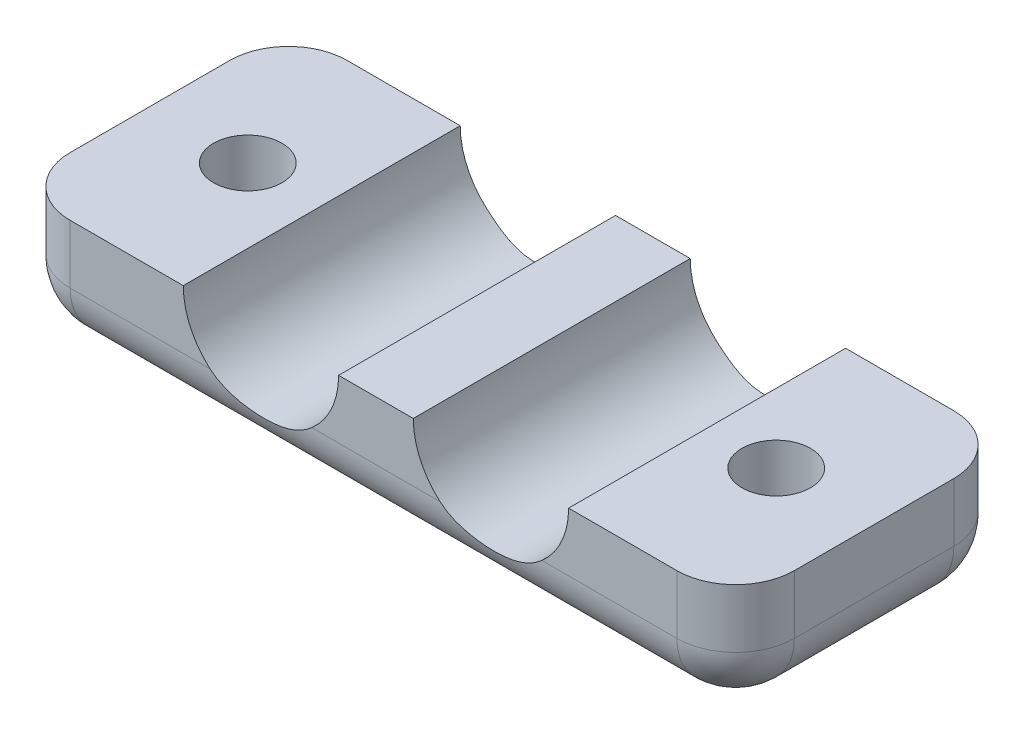
from build123d import *

# Parameters (mm, degrees)
ESBO_O1_W                = 37
ESBO_O1_H                = 6
RESSALTO_EXTRUS_O1_DEPTH = 14.15
ESBO_O2_R                = 3.96875
CORTE_EXTRUS_O1_DEPTH    = 25.051455257
ESBO_O3_R                = 1.75
CORTE_EXTRUS_O2_DEPTH    = 13
FILETE2_R                = 3
FILETE3_R                = 3


with BuildPart() as part:
    # Esboço1 → Ressalto-extrusão1 (new body)
    with BuildSketch(Plane.XY):
        with Locations((0, -3)):
            Rectangle(ESBO_O1_W, ESBO_O1_H)
    extrude(amount=RESSALTO_EXTRUS_O1_DEPTH)

    # Esboço2 → Corte-extrusão1 (cut, through all)
    with BuildSketch(Plane(origin=(0, 0, 0), x_dir=(-1, 0, 0), z_dir=(0, 0, -1))):
        with Locations((-6, 0)):
            Circle(ESBO_O2_R)
        with Locations((5.752883735, 0)):
            Circle(ESBO_O2_R)
    extrude(amount=-CORTE_EXTRUS_O1_DEPTH, mode=Mode.SUBTRACT)

    # Esboço3 → Corte-extrusão2 (cut)
    with BuildSketch(Plane.XZ.offset(6)):
        with Locations(Location((-13.5, 7.075, 0), (0, 0, 270))):
            Circle(ESBO_O3_R)
        with Locations(Location((13.5, 7.075, 0), (0, 0, 270))):
            Circle(ESBO_O3_R)
    extrude(amount=-CORTE_EXTRUS_O2_DEPTH, mode=Mode.SUBTRACT)

    # Filete2
    # the kernel refuses this fillet: 3 mm, written as the material it takes off along each edge
    with BuildSketch(Plane(origin=(-26, -6, 0), x_dir=(0, 1, 0), z_dir=(1, 0, 0))) as filete2_piece_1:
        with BuildLine():
            CenterArc((FILETE2_R, FILETE2_R), FILETE2_R, 180, 90)
            Line((0, FILETE2_R), (0, 0))
            Line((0, 0), (FILETE2_R, 0))
        make_face()
    extrude(amount=52, mode=Mode.SUBTRACT)
    with BuildSketch(Plane(origin=(-26, -6, 14.15), x_dir=(0, 1, 0), z_dir=(1, 0, 0))) as filete2_piece_2:
        with BuildLine():
            CenterArc((FILETE2_R, -FILETE2_R), FILETE2_R, 90, 90)
            Line((0, -FILETE2_R), (0, 0))
            Line((0, 0), (FILETE2_R, 0))
        make_face()
    extrude(amount=52, mode=Mode.SUBTRACT)
    with BuildSketch(Plane(origin=(-18.5, -6, -7.5), x_dir=(1, 0, 0), z_dir=(0, 0, 1)), Plane(origin=(18.5, -6, -7.5), x_dir=(0, 1, 0), z_dir=(0, 0, 1))) as filete2_piece_3:
        with BuildLine():
            CenterArc((FILETE2_R, FILETE2_R), FILETE2_R, 180, 90)
            Line((0, FILETE2_R), (0, 0))
            Line((0, 0), (FILETE2_R, 0))
        make_face()
    extrude(amount=29.15, mode=Mode.SUBTRACT)

    # Filete3
    # the kernel refuses this fillet: 3 mm, written as the material it takes off along each edge
    with BuildSketch(Plane(origin=(15.5, -3, 11.15), x_dir=(0, 0, 1), z_dir=(1, 0, 0))) as filete3_piece_1_section:
        Polygon((0, 0), (FILETE3_R, 0), (FILETE3_R, FILETE3_R), (0, FILETE3_R), align=None)
    filete3_piece_1 = extrude(amount=FILETE3_R, mode=Mode.PRIVATE)
    filete3_piece_1 = filete3_piece_1 - Plane(origin=(15.5, -3, 11.15), x_dir=(0, 0.7071067811865475, -0.7071067811865475), z_dir=(1, 0, 0)) * Sphere(FILETE3_R, mode=Mode.PRIVATE)
    add(filete3_piece_1, mode=Mode.SUBTRACT)
    with BuildSketch(Plane(origin=(15.5, -3, 3), x_dir=(1, 0, 0), z_dir=(0, 0, -1))) as filete3_piece_2_section:
        Polygon((0, 0), (FILETE3_R, 0), (FILETE3_R, FILETE3_R), (0, FILETE3_R), align=None)
    filete3_piece_2 = extrude(amount=FILETE3_R, mode=Mode.PRIVATE)
    filete3_piece_2 = filete3_piece_2 - Plane(origin=(15.5, -3, 3), x_dir=(-0.7071067811865472, 0.7071067811865477, 0), z_dir=(0, 0, -1)) * Sphere(FILETE3_R, mode=Mode.PRIVATE)
    add(filete3_piece_2, mode=Mode.SUBTRACT)
    with BuildSketch(Plane(origin=(-15.5, -3, 11.15), x_dir=(-1, 0, 0), z_dir=(0, 0, 1))) as filete3_piece_3_section:
        Polygon((0, 0), (FILETE3_R, 0), (FILETE3_R, FILETE3_R), (0, FILETE3_R), align=None)
    filete3_piece_3 = extrude(amount=FILETE3_R, mode=Mode.PRIVATE)
    filete3_piece_3 = filete3_piece_3 - Plane(origin=(-15.5, -3, 11.15), x_dir=(0.7071067811865472, 0.7071067811865477, 0), z_dir=(0, 0, 1)) * Sphere(FILETE3_R, mode=Mode.PRIVATE)
    add(filete3_piece_3, mode=Mode.SUBTRACT)
    with BuildSketch(Plane(origin=(-15.5, -3, 3), x_dir=(-1, 0, 0), z_dir=(0, 0, -1))) as filete3_piece_4_section:
        Polygon((0, 0), (FILETE3_R, 0), (FILETE3_R, -FILETE3_R), (0, -FILETE3_R), align=None)
    filete3_piece_4 = extrude(amount=FILETE3_R, mode=Mode.PRIVATE)
    filete3_piece_4 = filete3_piece_4 - Plane(origin=(-15.5, -3, 3), x_dir=(0.7071067811865472, 0.7071067811865477, 0), z_dir=(0, 0, -1)) * Sphere(FILETE3_R, mode=Mode.PRIVATE)
    add(filete3_piece_4, mode=Mode.SUBTRACT)
    with BuildSketch(Plane(origin=(18.5, -3, 14.15), x_dir=(0, 0, -1), z_dir=(0, 1, 0)), Plane(origin=(-18.5, 7.5, 0), x_dir=(1, 0, 0), z_dir=(0, -1, 0)), Plane(origin=(18.5, -3, 0), x_dir=(-1, 0, 0), z_dir=(0, 1, 0))) as filete3_piece_5:
        with BuildLine():
            CenterArc((FILETE3_R, FILETE3_R), FILETE3_R, 180, 90)
            Line((0, FILETE3_R), (0, 0))
            Line((0, 0), (FILETE3_R, 0))
        make_face()
    extrude(amount=10.5, mode=Mode.SUBTRACT)
    with BuildSketch(Plane(origin=(-18.5, 7.5, 14.15), x_dir=(1, 0, 0), z_dir=(0, -1, 0))) as filete3_piece_6:
        with BuildLine():
            CenterArc((FILETE3_R, -FILETE3_R), FILETE3_R, 90, 90)
            Line((0, -FILETE3_R), (0, 0))
            Line((0, 0), (FILETE3_R, 0))
        make_face()
    extrude(amount=10.5, mode=Mode.SUBTRACT)


solid = part.part
